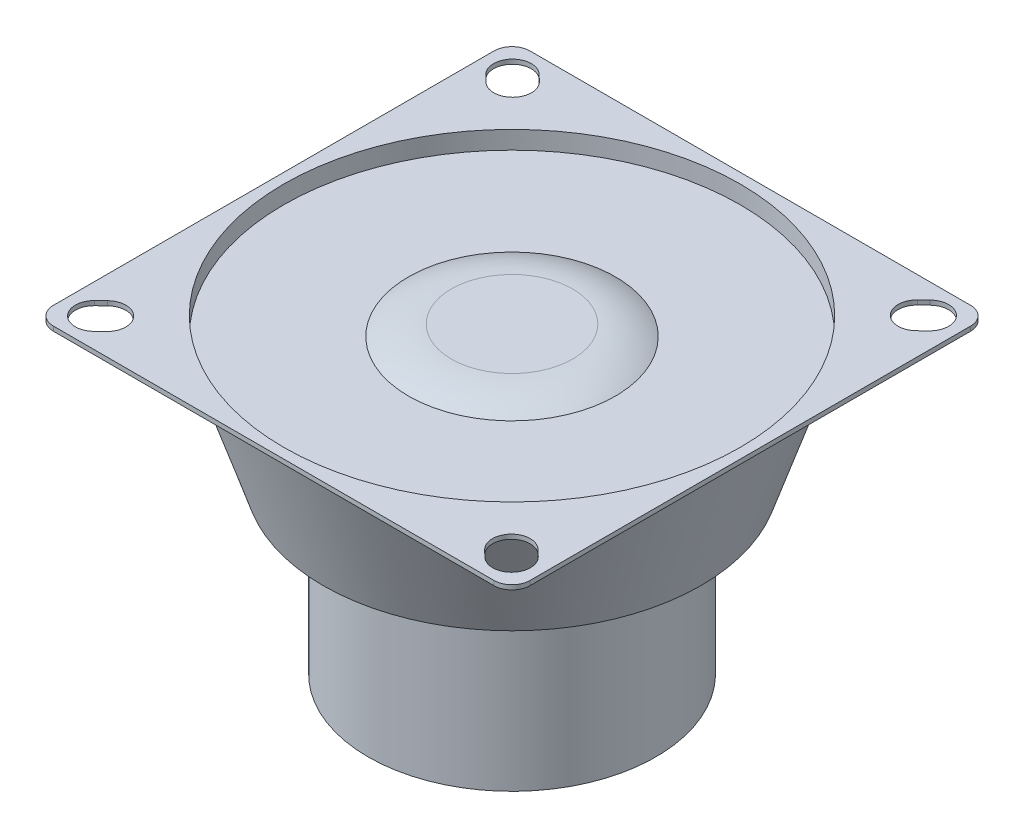
from build123d import *

# Parameters (mm, degrees)
ESQUISSE2_R             = 16
BOSS_EXTRU_1_DEPTH      = 19
ESQUISSE3_R             = 21
BOSS_EXTRU_2_DEPTH      = 15
D_POUILLE1_ANGLE        = 18.5
BOSS_EXTRU_3_DEPTH      = 0.5
ESQUISSE5_R             = 25.375
ENL_V_MAT_EXTRU_1_DEPTH = 2
ESQUISSE6_R             = 11.5
BOSS_EXTRU_4_DEPTH      = 1.2
CONG_1_R                = 10
ENL_V_MAT_EXTRU_2_DEPTH = 10


with BuildPart() as part:
    # Esquisse2 → Boss.-Extru.1 (new body)
    with BuildSketch(Plane(origin=(0, 0, 0), x_dir=(1, 0, 0), z_dir=(0, 1, 0))):
        with Locations(Location((0, 0, 0), (0, 0, 270))):
            Circle(ESQUISSE2_R)
    extrude(amount=BOSS_EXTRU_1_DEPTH)

    # Esquisse3 → Boss.-Extru.2 (add)
    with BuildSketch(Plane(origin=(0, 19, 0), x_dir=(1, 0, 0), z_dir=(0, 1, 0))):
        with Locations(Location((0, 0, 0), (0, 0, 270))):
            Circle(ESQUISSE3_R)
    extrude(amount=BOSS_EXTRU_2_DEPTH)

    # Dépouille1
    d_pouille1_faces = [part.faces().sort_by_distance(p)[0] for p in [
        (0, 26.5, -21),
    ]]
    draft(d_pouille1_faces, Plane(origin=(0, 19, 0), x_dir=(0, 0, -1), z_dir=(0, -1, 0)), D_POUILLE1_ANGLE)

    # Esquisse4 → Boss.-Extru.3 (add)
    with BuildSketch(Plane(origin=(0, 34, 0), x_dir=(1, 0, 0), z_dir=(0, 1, 0))):
        with BuildLine():
            Line((-24.5, 26.5), (24.5, 26.5))
            ThreePointArc((24.5, 26.5), (25.914213562, 25.914213562), (26.5, 24.5))
            Line((26.5, 24.5), (26.5, -24.5))
            ThreePointArc((26.5, -24.5), (25.914213562, -25.914213562), (24.5, -26.5))
            Line((24.5, -26.5), (-24.5, -26.5))
            ThreePointArc((-24.5, -26.5), (-25.914213562, -25.914213562), (-26.5, -24.5))
            Line((-26.5, -24.5), (-26.5, 24.5))
            ThreePointArc((-26.5, 24.5), (-25.914213562, 25.914213562), (-24.5, 26.5))
        make_face()
    extrude(amount=BOSS_EXTRU_3_DEPTH)

    # Esquisse5 → Enlèv. mat.-Extru.1 (cut)
    with BuildSketch(Plane(origin=(0, 34.5, 0), x_dir=(1, 0, 0), z_dir=(0, 1, 0))):
        with Locations(Location((0, 0, 0), (0, 0, 270))):
            Circle(ESQUISSE5_R)
    extrude(amount=-ENL_V_MAT_EXTRU_1_DEPTH, mode=Mode.SUBTRACT)

    # Esquisse6 → Boss.-Extru.4 (add)
    with BuildSketch(Plane(origin=(0, 32.5, 0), x_dir=(1, 0, 0), z_dir=(0, 1, 0))):
        with Locations(Location((0, 0, 0), (0, 0, 270))):
            Circle(ESQUISSE6_R)
    extrude(amount=BOSS_EXTRU_4_DEPTH)

    # Congé1
    # the kernel refuses this fillet: 10 mm, written as the material it takes off along each edge
    with BuildSketch(Plane(origin=(0, 33.7, 0), x_dir=(0, 0, 1), z_dir=(-1, 0, 0))) as cong_1_piece_1:
        with BuildLine():
            CenterArc((6.750263165, -10), CONG_1_R, 61.642363424, 28.357636576)
            Line((6.750263165, 0), (6.750263165, 0.2))
            Line((6.750263165, 0.2), (11.5, 0.2))
            Line((11.5, 0.2), (11.7, 0))
            ThreePointArc((11.7, 0), (11.7, -0.6), (11.594994737, -1.024))
            Line((11.594994737, -1.024), (11.5, -1.2))
        make_face()
    revolve(axis=Axis((0, 33.7, 0), (0, 1, 0)), mode=Mode.SUBTRACT)

    # Esquisse7 → Enlèv. mat.-Extru.2 (cut)
    with BuildSketch(Plane(origin=(0, 34.5, 0), x_dir=(1, 0, 0), z_dir=(0, 1, 0))):
        with BuildLine():
            Line((21.024040871, 24.065615546), (21.74268552, 24.760993047))
            ThreePointArc((21.74268552, 24.760993047), (24.712132034, 24.712132034), (24.663271022, 21.74268552))
            Line((24.663271022, 21.74268552), (23.944626373, 21.04730802))
            ThreePointArc((23.944626373, 21.04730802), (20.975179858, 21.096169032), (21.024040871, 24.065615546))
        make_face()
        with BuildLine():
            Line((-21.024040871, 24.065615546), (-21.74268552, 24.760993047))
            ThreePointArc((-21.74268552, 24.760993047), (-24.712132034, 24.712132034), (-24.663271022, 21.74268552))
            Line((-24.663271022, 21.74268552), (-23.944626373, 21.04730802))
            ThreePointArc((-23.944626373, 21.04730802), (-20.975179858, 21.096169032), (-21.024040871, 24.065615546))
        make_face()
        with BuildLine():
            Line((21.024040871, -24.065615546), (21.74268552, -24.760993047))
            ThreePointArc((21.74268552, -24.760993047), (24.712132034, -24.712132034), (24.663271022, -21.74268552))
            Line((24.663271022, -21.74268552), (23.944626373, -21.04730802))
            ThreePointArc((23.944626373, -21.04730802), (20.975179858, -21.096169032), (21.024040871, -24.065615546))
        make_face()
        with BuildLine():
            Line((-21.024040871, -24.065615546), (-21.74268552, -24.760993047))
            ThreePointArc((-21.74268552, -24.760993047), (-24.712132034, -24.712132034), (-24.663271022, -21.74268552))
            Line((-24.663271022, -21.74268552), (-23.944626373, -21.04730802))
            ThreePointArc((-23.944626373, -21.04730802), (-20.975179858, -21.096169032), (-21.024040871, -24.065615546))
        make_face()
    extrude(amount=-ENL_V_MAT_EXTRU_2_DEPTH, mode=Mode.SUBTRACT)


solid = part.part
